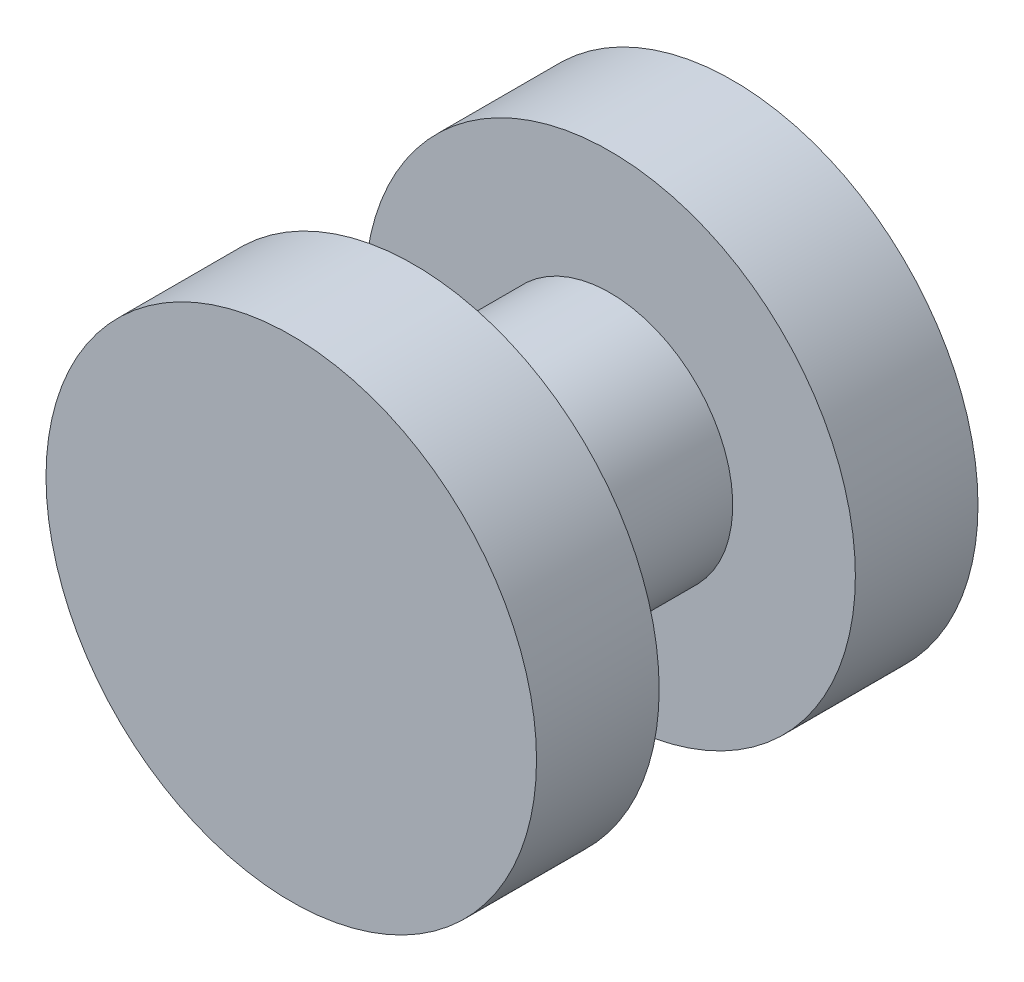
from build123d import *

# Parameters (mm, degrees)
SKETCH1_R           = 3.175
BOSS_EXTRUDE1_DEPTH = 5.08
SKETCH2_R           = 6.35
BOSS_EXTRUDE2_DEPTH = 3.175
BOSS_EXTRUDE3_START = 3.175
SKETCH3_R           = 6.35
BOSS_EXTRUDE3_DEPTH = 3.175


with BuildPart() as part:
    # Sketch1 → Boss-Extrude1 (new body)
    with BuildSketch(Plane.XY):
        Circle(SKETCH1_R)
    extrude(amount=BOSS_EXTRUDE1_DEPTH)

    # Sketch2 → Boss-Extrude2 (add)
    with BuildSketch(Plane(origin=(0, 0, 0), x_dir=(-1, 0, 0), z_dir=(0, 0, -1))):
        Circle(SKETCH2_R)
    extrude(amount=BOSS_EXTRUDE2_DEPTH)

    # Sketch3 → Boss-Extrude3 (add)
    with BuildSketch(Plane.XY.offset(5.08).offset(BOSS_EXTRUDE3_START)):
        Circle(SKETCH3_R)
    extrude(amount=-BOSS_EXTRUDE3_DEPTH)


solid = part.part
